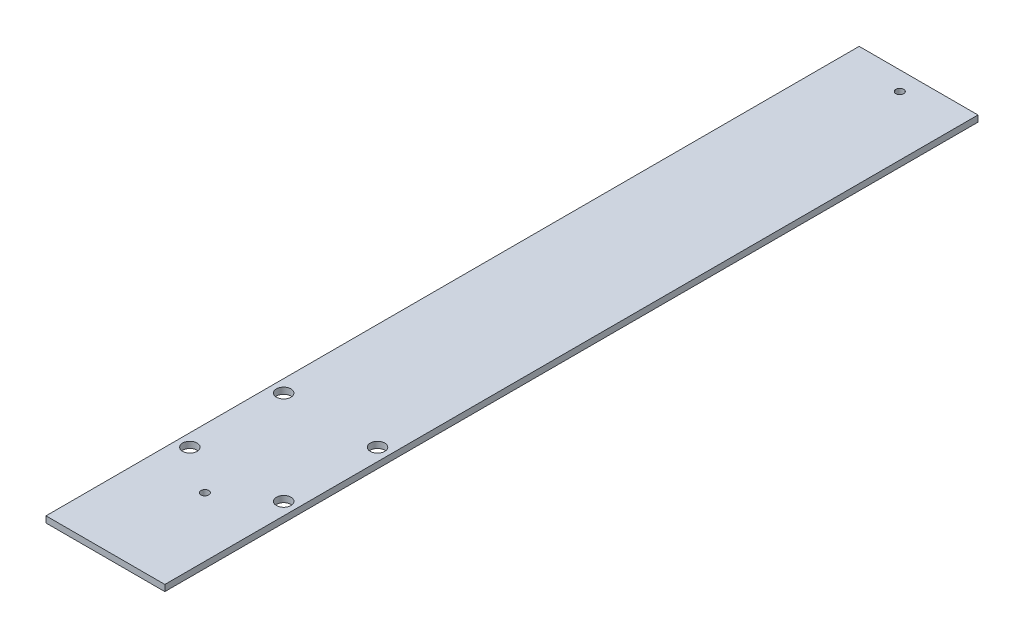
from build123d import *

# Parameters (mm, degrees)
SKETCH1_W               = 241.3
SKETCH1_H               = 1651
BOSS_EXTRUDE1_DEPTH     = 12.7
CUT_EXTRUDE1_DEPTH      = 1669.588619163
CUT_EXTRUDE1_DEPTH_BACK = 1669.588619163
SKETCH2_R               = 7.9375
SKETCH3_R               = 14.72946
CUT_EXTRUDE2_DEPTH      = 1669.588619163


with BuildPart() as part:
    # Sketch1 → Boss-Extrude1 (new body)
    with BuildSketch(Plane(origin=(0, 0, 0), x_dir=(1, 0, 0), z_dir=(0, 1, 0))):
        with Locations((120.65, -825.5)):
            Rectangle(SKETCH1_W, SKETCH1_H)
    extrude(amount=BOSS_EXTRUDE1_DEPTH)

    # Sketch2 → Cut-Extrude1 (cut, two sides: drawn at the far end of the back side and taken through both)
    with BuildSketch(Plane(origin=(0, 12.7, 0), x_dir=(1, 0, 0), z_dir=(0, 1, 0)).offset(-CUT_EXTRUDE1_DEPTH_BACK)):
        with Locations((120.65, -38.1)):
            Circle(SKETCH2_R)
        with Locations((120.65, -1449.0573)):
            Circle(SKETCH2_R)
    extrude(amount=CUT_EXTRUDE1_DEPTH + CUT_EXTRUDE1_DEPTH_BACK, mode=Mode.SUBTRACT)

    # Sketch3 → Cut-Extrude2 (cut, through all)
    with BuildSketch(Plane.XZ):
        with Locations((215.9, 1193.8)):
            Circle(SKETCH3_R)
        with Locations((25.4, 1193.8)):
            Circle(SKETCH3_R)
        with Locations((25.4, 1384.3)):
            Circle(SKETCH3_R)
        with Locations((215.9, 1384.3)):
            Circle(SKETCH3_R)
    extrude(amount=-CUT_EXTRUDE2_DEPTH, mode=Mode.SUBTRACT)


solid = part.part
